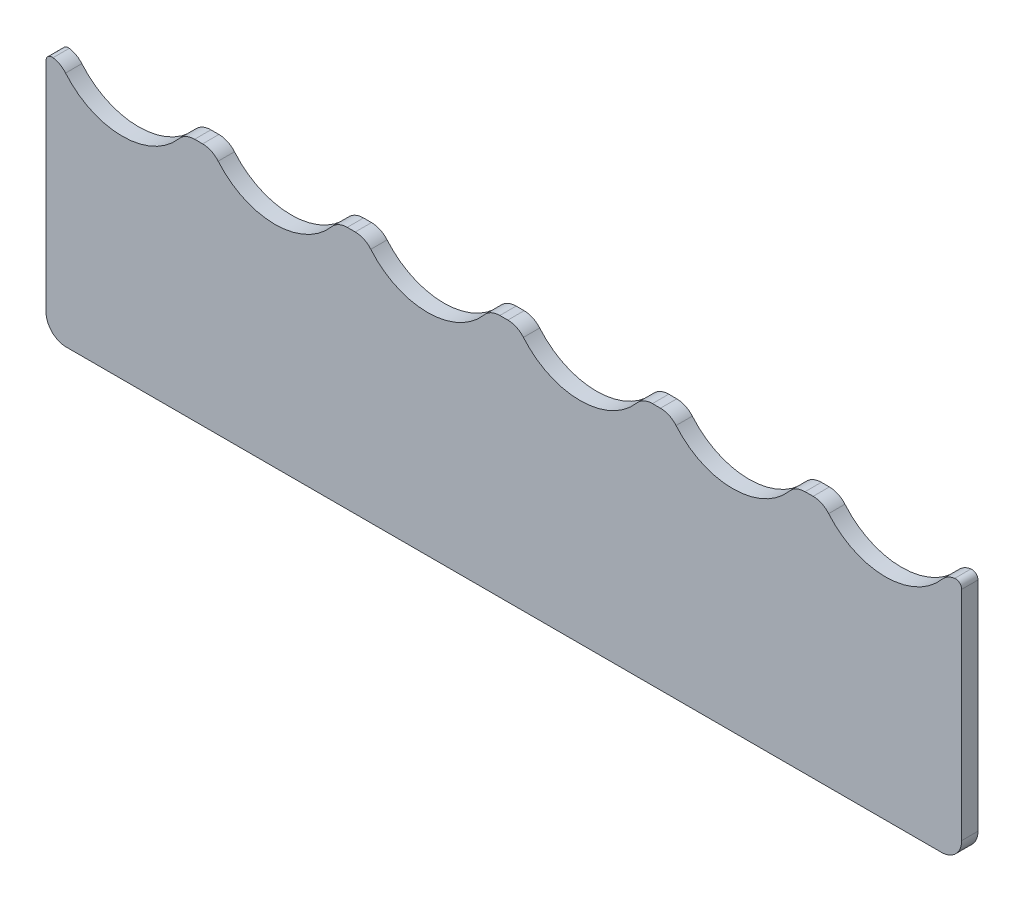
from build123d import *

# Parameters (mm, degrees)
ESQUISSE1_W                  = 450
ESQUISSE1_H                  = 120
BOSS_EXTRU_1_DEPTH           = 8
ENL_V_MAT_EXTRU_1_DEPTH      = 466.79394586
ENL_V_MAT_EXTRU_1_DEPTH_BACK = 466.79394586
ESQUISSE2_R                  = 36.5
CONG_1_R                     = 10
CONG_2_R                     = 3


with BuildPart() as part:
    # Esquisse1 → Boss.-Extru.1 (new body)
    with BuildSketch(Plane.XY):
        with Locations((225, 60)):
            Rectangle(ESQUISSE1_W, ESQUISSE1_H)
    extrude(amount=BOSS_EXTRU_1_DEPTH)

    # Esquisse2 → Enlèv. mat.-Extru.1 (cut, two sides: drawn at the far end of the back side and taken through both)
    with BuildSketch(Plane.XY.offset(8).offset(-ENL_V_MAT_EXTRU_1_DEPTH_BACK)):
        with Locations((187.5, 140)):
            Circle(ESQUISSE2_R)
        with Locations((112.5, 140)):
            Circle(ESQUISSE2_R)
        with Locations((37.5, 140)):
            Circle(ESQUISSE2_R)
        with Locations((412.5, 140)):
            Circle(ESQUISSE2_R)
        with Locations((337.5, 140)):
            Circle(ESQUISSE2_R)
        with Locations((262.5, 140)):
            Circle(ESQUISSE2_R)
    extrude(amount=ENL_V_MAT_EXTRU_1_DEPTH + ENL_V_MAT_EXTRU_1_DEPTH_BACK, mode=Mode.SUBTRACT)

    # Congé1
    cong_1_edges = [part.edges().sort_by_distance(p)[0] for p in [
        (6.967230718, 120, 4),
        (443.032769282, 120, 4),
        (381.967230718, 120, 4),
        (368.032769282, 120, 4),
        (306.967230718, 120, 4),
        (293.032769282, 120, 4),
        (231.967230718, 120, 4),
        (218.032769282, 120, 4),
        (156.967230718, 120, 4),
        (143.032769282, 120, 4),
        (81.967230718, 120, 4),
        (68.032769282, 120, 4),
        (450, 0, 4),
        (0, 0, 4),
    ]]
    fillet(cong_1_edges, radius=CONG_1_R)

    # Congé2
    cong_2_edges = [part.edges().sort_by_distance(p)[0] for p in [
        (450, 120, 4),
        (0, 120, 4),
    ]]
    fillet(cong_2_edges, radius=CONG_2_R)


solid = part.part
